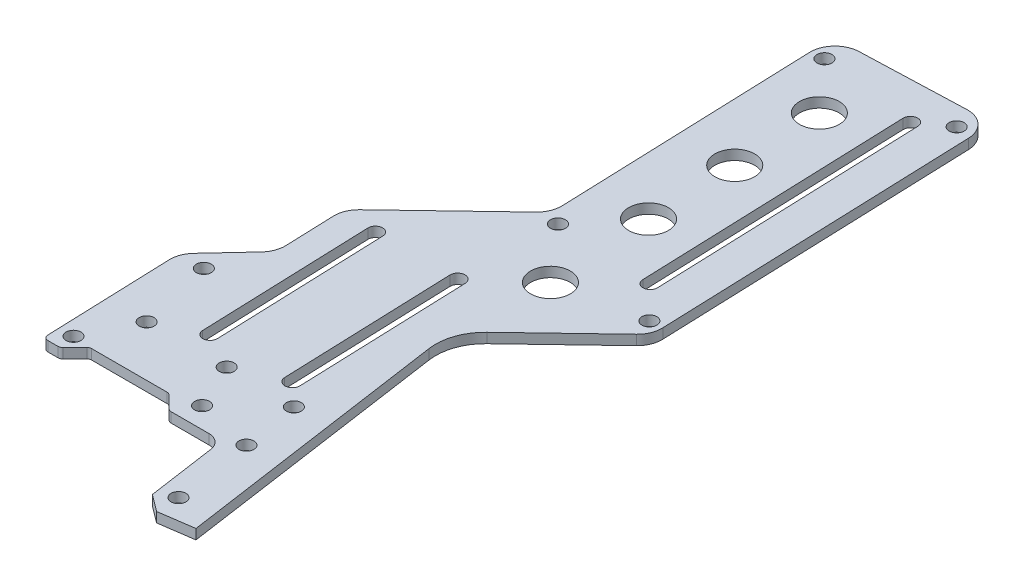
from build123d import *

# Parameters (mm, degrees)
SKETCH1_R           = 1.5
BOSS_EXTRUDE1_DEPTH = 2
SKETCH2_R           = 4
CUT_EXTRUDE1_DEPTH  = 136.757961465
SKETCH3_R           = 1.5
CUT_EXTRUDE2_DEPTH  = 10
FILLET1_R           = 10
CUT_EXTRUDE3_DEPTH  = 23
FILLET2_R           = 1


with BuildPart() as part:
    # Sketch1 → Boss-Extrude1 (new body)
    with BuildSketch(Plane(origin=(0, 0, 0), x_dir=(1, 0, 0), z_dir=(0, 1, 0))):
        with BuildLine():
            Line((35.946087305, 32.589224444), (55.068611132, 50.836380863))
            ThreePointArc((55.068611132, 50.836380863), (56.248023483, 52.569022886), (56.613633222, 54.632852189))
            Line((56.613633222, 54.632852189), (54.322448331, 118.551544644))
            ThreePointArc((54.322448331, 118.551544644), (52.732271224, 122.032348819), (49.146545971, 123.369224039))
            Line((49.146545971, 123.369224039), (28.149749669, 122.616587516))
            ThreePointArc((28.149749669, 122.616587516), (24.668945494, 121.026410408), (23.332070273, 117.440685156))
            Line((23.332070273, 117.440685156), (25.181696492, 65.840445524))
            ThreePointArc((25.181696492, 65.840445524), (24.816086753, 63.776616221), (23.636674402, 62.043974198))
            Line((23.636674402, 62.043974198), (5.476247543, 44.714873053))
            ThreePointArc((5.476247543, 44.714873053), (4.296835192, 42.98223103), (3.931225452, 40.918401728))
            Line((3.931225452, 40.918401728), (4.285331317, 31.039677436))
            ThreePointArc((4.285331317, 31.039677436), (3.973516256, 29.113854302), (2.948456097, 27.453952183))
            Line((2.948456097, 27.453952183), (-3.659915658, 20.354208893))
            ThreePointArc((-3.659915658, 20.354208893), (-4.684975817, 18.694306775), (-4.996790878, 16.768483641))
            Line((-4.996790878, 16.768483641), (-4.053596951, -9.544417952))
            Line((-4.053596951, -9.544417952), (-0.700132194, -9.544417952))
            Line((-0.700132194, -9.544417952), (2.299867806, -6.544417952))
            Line((2.299867806, -6.544417952), (18.299867806, -6.544417952))
            Line((18.299867806, -6.544417952), (21.299867806, -9.544417952))
            Line((21.299867806, -9.544417952), (26.299867806, -9.544417952))
            Line((26.299867806, -9.544417952), (28.299867806, -9.544417952))
            Line((28.299867806, -9.544417952), (29.317405641, -9.544417952))
            ThreePointArc((29.317405641, -9.544417952), (31.281555871, -10.276794995), (32.286707076, -12.116342036))
            Line((32.286707076, -12.116342036), (34.27107148, -25.880667111))
            Line((34.27107148, -25.880667111), (37.668448831, -28.421892629))
            Line((37.668448831, -28.421892629), (44.597867771, -27.422897603))
            Line((44.597867771, -27.422897603), (40.206014976, 3.040705467))
            Line((40.206014976, 3.040705467), (35.946087305, 32.589224444))
        make_face()
        with Locations((23.770367042, -5.370271096)):
            Circle(SKETCH1_R, mode=Mode.SUBTRACT)
        with Locations((19.540458754, 3.826449386)):
            Circle(SKETCH1_R, mode=Mode.SUBTRACT)
        with Locations((-1.280541484, -6.226605145)):
            Circle(SKETCH1_R, mode=Mode.SUBTRACT)
        with Locations((3.564149135, 3.664002019)):
            Circle(SKETCH1_R, mode=Mode.SUBTRACT)
    extrude(amount=BOSS_EXTRUDE1_DEPTH)

    # Sketch2 → Cut-Extrude1 (cut, through all)
    with BuildSketch(Plane.XZ):
        with Locations((34.893536441, -107.909402778)):
            Circle(SKETCH2_R)
        with Locations((35.500605714, -90.244703074)):
            Circle(SKETCH2_R)
        with Locations((37.375632996, -51.234404776)):
            Circle(SKETCH2_R)
        with Locations((36.193690526, -72.178757044)):
            Circle(SKETCH2_R)
        with BuildLine():
            Line((9.476681481, -42.336326168), (10.714476932, -7.804732036))
            ThreePointArc((10.714476932, -7.804732036), (12.221884959, -6.401651358), (13.624965636, -7.909059385))
            Line((13.624965636, -7.909059385), (12.387170186, -42.440653517))
            ThreePointArc((12.387170186, -42.440653517), (10.879762159, -43.843734194), (9.476681481, -42.336326168))
        make_face()
        with BuildLine():
            Line((25.946876638, -42.39809035), (27.184672089, -7.866496218))
            ThreePointArc((27.184672089, -7.866496218), (28.736682558, -6.421900022), (30.181278754, -7.973910491))
            Line((30.181278754, -7.973910491), (28.943483303, -42.505504623))
            ThreePointArc((28.943483303, -42.505504623), (27.391472834, -43.950100819), (25.946876638, -42.39809035))
        make_face()
        with BuildLine():
            Line((44.239527936, -115.417065328), (46.189170661, -61.026599384))
            ThreePointArc((46.189170661, -61.026599384), (47.693530634, -59.626355806), (49.093774212, -61.130715778))
            Line((49.093774212, -61.130715778), (47.144131486, -115.521181722))
            ThreePointArc((47.144131486, -115.521181722), (45.639771514, -116.9214253), (44.239527936, -115.417065328))
        make_face()
    extrude(amount=-CUT_EXTRUDE1_DEPTH, mode=Mode.SUBTRACT)

    # Sketch3 → Cut-Extrude2 (cut)
    with BuildSketch(Plane(origin=(0, 2, 0), x_dir=(1, 0, 0), z_dir=(0, 1, 0))):
        with Locations((0, 18.76051869)):
            Circle(SKETCH3_R)
        with Locations((54.054577559, 54.488184987)):
            Circle(SKETCH3_R)
        with Locations((25.943400363, 117.871083174)):
            Circle(SKETCH3_R)
        with Locations((51.146049593, 119.311681239)):
            Circle(SKETCH3_R)
        with Locations((27.939408723, 62.187124606)):
            Circle(SKETCH3_R)
        with Locations((33.240387063, 3.660878573)):
            Circle(SKETCH3_R)
    extrude(amount=-CUT_EXTRUDE2_DEPTH, mode=Mode.SUBTRACT)

    # Fillet1
    fillet1_edges = [part.edges().sort_by_distance(p)[0] for p in [
        (35.946087305, 1, -32.589224444),
    ]]
    fillet(fillet1_edges, radius=FILLET1_R)

    # Sketch4 → Cut-Extrude3 (cut)
    with BuildSketch(Plane.XZ):
        with BuildLine():
            ThreePointArc((36.806162994, 22.440741914), (38.934316746, 23.581659248), (37.215093343, 25.27724223))
            ThreePointArc((37.215093343, 25.27724223), (35.965015311, 24.009735165), (36.806162994, 22.440741914))
        make_face()
        with BuildLine():
            ThreePointArc((34.909100758, 9.281978715), (33.659022726, 8.014471651), (34.500170409, 6.4454784))
            ThreePointArc((34.500170409, 6.4454784), (36.628324161, 7.586395734), (34.909100758, 9.281978715))
        make_face()
    extrude(amount=-CUT_EXTRUDE3_DEPTH, mode=Mode.SUBTRACT)

    # Fillet2
    fillet2_edges = [part.edges().sort_by_distance(p)[0] for p in [
        (21.299867806, 1, 9.544417952),
        (18.299867806, 1, 6.544417952),
        (2.299867806, 1, 6.544417952),
        (-0.700132194, 1, 9.544417952),
        (-4.053596951, 1, 9.544417952),
    ]]
    fillet(fillet2_edges, radius=FILLET2_R)


solid = part.part
